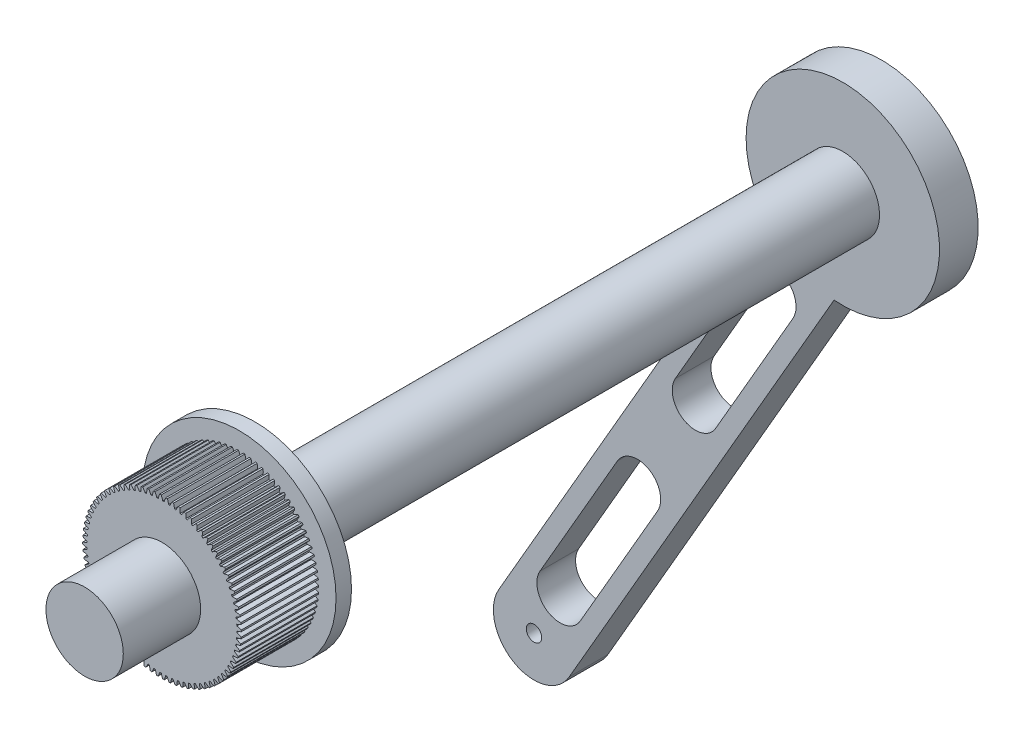
from build123d import *

# Parameters (mm, degrees)
SKETCH_1_R               = 125
EXTRUDE_1_DEPTH          = 20
EXTRUDE_2_DEPTH          = 100
PATTERN_CIRCULAR_1_COUNT = 80
SKETCH_3_R               = 96.875
EXTRUDE_3_DEPTH          = 100
SKETCH_4_R               = 50
EXTRUDE_4_DEPTH          = 100
SKETCH_5_R               = 47.5
EXTRUDE_5_DEPTH          = 760
EXTRUDE_START            = 50
EXTRUDE_6_DEPTH          = 50
CUT_EXTRUDE_1_DEPTH      = 1349.389792358
SKETCH_8_R               = 10
CUT_EXTRUDE_2_DEPTH      = 1349.389792358


with BuildPart() as part:
    # 草图1 → 凸台-拉伸1 (new body)
    with BuildSketch(Plane.XY):
        Circle(SKETCH_1_R)
    extrude(amount=EXTRUDE_1_DEPTH)

    # 草图2 → 凸台-拉伸2 (add)
    with BuildSketch(Plane.XY.offset(20)):
        with BuildLine():
            ThreePointArc((-0.972080728, -96.870122763), (1.902013957, -96.856326422), (4.774434461, -96.757275698))
            ThreePointArc((4.774434461, -96.757275698), (4.013534828, -99.645325021), (3.003585214, -102.455983114))
            ThreePointArc((3.003585214, -102.455983114), (2.012453477, -102.480242149), (1.021133461, -102.494913466))
            ThreePointArc((1.021133461, -102.494913466), (-0.098383436, -99.726072724), (-0.972080728, -96.870122763))
        make_face()
    extrude_2 = extrude(amount=EXTRUDE_2_DEPTH)

    # 阵列(圆周)1: 凸台-拉伸2 ×80 about axis
    pattern_circular_1_axis = Axis((0, 0, 20), (0, 0, 1))
    for i in range(1, PATTERN_CIRCULAR_1_COUNT):
        add(extrude_2.rotate(pattern_circular_1_axis, i * 360 / PATTERN_CIRCULAR_1_COUNT))

    # 草图3 → 凸台-拉伸3 (add)
    with BuildSketch(Plane.XY.offset(20)):
        Circle(SKETCH_3_R)
    extrude(amount=EXTRUDE_3_DEPTH)

    # 草图4 → 凸台-拉伸4 (add)
    with BuildSketch(Plane.XY.offset(120)):
        Circle(SKETCH_4_R)
    extrude(amount=EXTRUDE_4_DEPTH)

    # 草图5 → 凸台-拉伸5 (add)
    with BuildSketch(Plane(origin=(0, 0, 0), x_dir=(-1, 0, 0), z_dir=(0, 0, -1))):
        Circle(SKETCH_5_R)
    extrude(amount=EXTRUDE_5_DEPTH)

    # 草图6 → 凸台-拉伸6 (add)
    with BuildSketch(Plane(origin=(0, 0, -760), x_dir=(-1, 0, 0), z_dir=(0, 0, -1)).offset(EXTRUDE_START)):
        with BuildLine():
            Line((11.253922824, -124.492366116), (353.671408816, -717.576849254))
            ThreePointArc((353.671408816, -717.576849254), (425.387742515, -736.793182953), (444.604076214, -665.076849254))
            Line((444.604076214, -665.076849254), (102.186590221, -71.992366116))
            ThreePointArc((102.186590221, -71.992366116), (-57.558466951, 110.959555164), (0, -125))
            ThreePointArc((0, -125), (5.632682999, -124.87302704), (11.253922824, -124.492366116))
        make_face()
    extrude(amount=-EXTRUDE_6_DEPTH)

    # 草图7 → 切除-拉伸1 (cut, through all)
    with BuildSketch(Plane(origin=(0, 0, -810), x_dir=(-1, 0, 0), z_dir=(0, 0, -1))):
        with BuildLine():
            Line((164.448237405, -344.832702401), (64.448237405, -171.627621644))
            ThreePointArc((64.448237405, -171.627621644), (75.428999519, -130.646859531), (116.409761632, -141.627621644))
            Line((116.409761632, -141.627621644), (216.409761632, -314.832702401))
            ThreePointArc((216.409761632, -314.832702401), (205.428999519, -355.813464515), (164.448237405, -344.832702401))
        make_face()
        with BuildLine():
            Line((291.409761632, -444.736512969), (391.409761632, -617.941593726))
            ThreePointArc((391.409761632, -617.941593726), (380.428999519, -658.922355839), (339.448237405, -647.941593726))
            Line((339.448237405, -647.941593726), (239.448237405, -474.736512969))
            ThreePointArc((239.448237405, -474.736512969), (250.428999519, -433.755750855), (291.409761632, -444.736512969))
        make_face()
    extrude(amount=-CUT_EXTRUDE_1_DEPTH, mode=Mode.SUBTRACT)

    # 草图8 → 切除-拉伸2 (cut, through all)
    with BuildSketch(Plane(origin=(0, 0, -810), x_dir=(-1, 0, 0), z_dir=(0, 0, -1))):
        with Locations((399.137742515, -691.326849254)):
            Circle(SKETCH_8_R)
    extrude(amount=-CUT_EXTRUDE_2_DEPTH, mode=Mode.SUBTRACT)


solid = part.part
